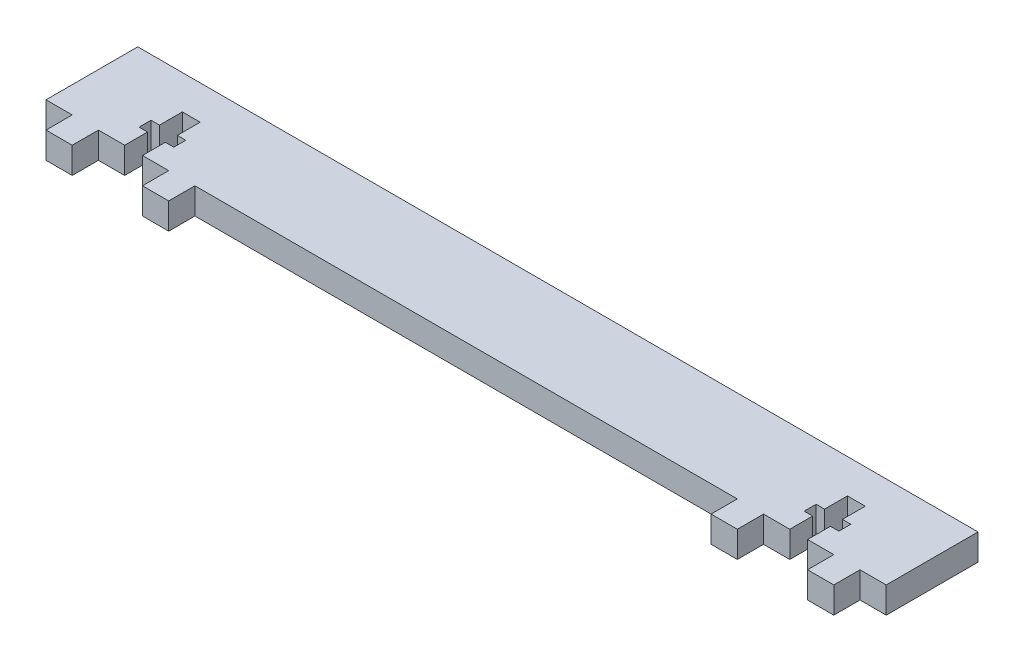
from build123d import *

# Parameters (mm, degrees)
BOSS_EXTRUDE1_DEPTH = 6.35


with BuildPart() as part:
    # Sketch1 → Boss-Extrude1 (new body)
    with BuildSketch(Plane(origin=(0, 0, 0), x_dir=(1, 0, 0), z_dir=(0, 1, 0))):
        Polygon((-101.7524, 11.1125), (-101.7524, -11.1125), (-95.4024, -11.1125), (-95.4024, -17.4625), (-89.0524, -17.4625), (-89.0524, -11.1125), (-82.7024, -11.1125), (-82.7024, -5.577500021), (-84.743399982, -5.577500021), (-84.743399982, -2.677499979), (-82.7024, -2.677499979), (-82.7024, 2.8575), (-78.3844, 2.8575), (-78.3844, -2.677499979), (-76.343400018, -2.677499979), (-76.343400018, -5.577500021), (-78.3844, -5.577500021), (-78.3844, -11.1125), (-72.0344, -11.1125), (-72.0344, -17.4625), (-65.6844, -17.4625), (-65.6844, -11.1125), (65.6844, -11.1125), (65.6844, -17.4625), (72.0344, -17.4625), (72.0344, -11.1125), (78.3844, -11.1125), (78.3844, -5.577500021), (76.343400018, -5.577500021), (76.343400018, -2.677499979), (78.3844, -2.677499979), (78.3844, 2.8575), (82.7024, 2.8575), (82.7024, -2.677499979), (84.743399982, -2.677499979), (84.743399982, -5.577500021), (82.7024, -5.577500021), (82.7024, -11.1125), (89.0524, -11.1125), (89.0524, -17.4625), (95.4024, -17.4625), (95.4024, -11.1125), (101.7524, -11.1125), (101.7524, 11.1125), align=None)
    extrude(amount=BOSS_EXTRUDE1_DEPTH)


solid = part.part
